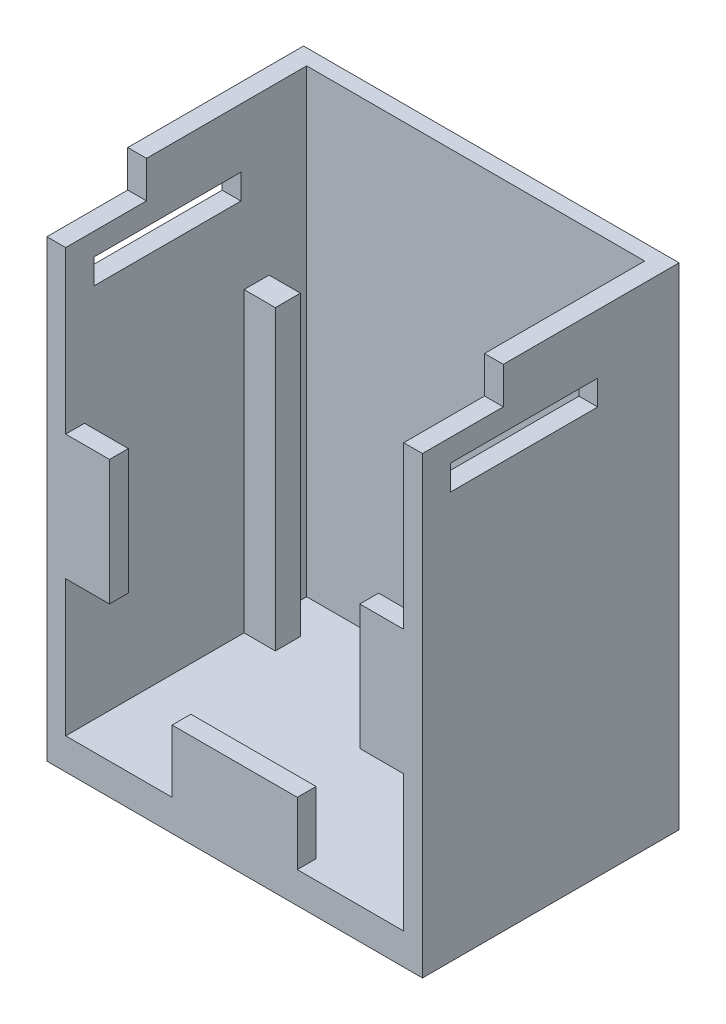
from build123d import *

# Parameters (mm, degrees)
INITIAL_BLOCK_DEPTH      = 19.05
INITIAL_BLOCK_DEPTH_BACK = 1.778
SKETCH1_W                = 30.48
SKETCH1_H                = 40.64
SKETCH2_W                = 27.432
SKETCH2_H                = 19.558
INITIAL_CUT_DEPTH        = 38.1
SKETCH20_W               = 5.08
SKETCH20_H               = 10.16
SKETCH20_W_2             = 10.16
SKETCH20_H_2             = 5.08
BOSS_EXTRUDE1_DEPTH      = 1.524
SKETCH21_W               = 2.032
SKETCH21_H               = 24.13
BOSS_EXTRUDE2_DEPTH      = 2.54
CUT_EXTRUDE6_REACH       = 46.012
SKETCH27_W               = 11.938
SKETCH27_H               = 2.032
SKETCH28_W               = 30.48
SKETCH28_H               = 1.778
CUT_EXTRUDE7_DEPTH       = 37.210815843
SKETCH29_W               = 30.48
SKETCH29_H               = 2
CUT_EXTRUDE8_DEPTH       = 5.81
BOSS_EXTRUDE3_DEPTH      = 0.99
SKETCH31_W               = 30.48
SKETCH31_H               = 2.99
CUT_EXTRUDE9_DEPTH       = 0.75


with BuildPart() as part:
    # Sketch1 → Initial Block (new, two sides: drawn at the far end of the back side and taken through both)
    with BuildSketch(Plane.XY.offset(-INITIAL_BLOCK_DEPTH_BACK)):
        with Locations((0, -5.08)):
            Rectangle(SKETCH1_W, SKETCH1_H)
    extrude(amount=INITIAL_BLOCK_DEPTH + INITIAL_BLOCK_DEPTH_BACK)

    # Sketch2 → Initial Cut (cut)
    with BuildSketch(Plane(origin=(0, 15.24, 0), x_dir=(1, 0, 0), z_dir=(0, 1, 0))):
        with Locations((0, -9.271)):
            Rectangle(SKETCH2_W, SKETCH2_H)
    extrude(amount=-INITIAL_CUT_DEPTH, mode=Mode.SUBTRACT)

    # Sketch20 → Boss-Extrude1 (add)
    with BuildSketch(Plane.XY.offset(19.05)):
        with Locations((-12.7, -6.731)):
            Rectangle(SKETCH20_W, SKETCH20_H)
        with Locations((12.7, -6.731)):
            Rectangle(SKETCH20_W, SKETCH20_H)
        with Locations((0, -20.32)):
            Rectangle(SKETCH20_W_2, SKETCH20_H_2)
    extrude(amount=-BOSS_EXTRUDE1_DEPTH)

    # Sketch21 → Boss-Extrude2 (add)
    with BuildSketch(Plane(origin=(-13.716, 0, 0), x_dir=(0, 0, -1), z_dir=(1, 0, 0))):
        with Locations((-3.556, -10.795)):
            Rectangle(SKETCH21_W, SKETCH21_H)
    boss_extrude2 = extrude(amount=BOSS_EXTRUDE2_DEPTH)

    # Mirror2: Boss-Extrude2 across plane
    add(boss_extrude2.mirror(Plane(origin=(0, 0, 0), x_dir=(0, 0, 1), z_dir=(1, 0, 0))))

    # Sketch27 → Cut-Extrude6 (cut, up to next)
    with BuildSketch(Plane(origin=(15.24, 0, 0), x_dir=(0, 0, -1), z_dir=(1, 0, 0)), mode=Mode.PRIVATE) as cut_extrude6_sk1:
        with Locations((-10.795, 8.636)):
            Rectangle(SKETCH27_W, SKETCH27_H)
    cut_extrude6_tool1 = extrude(cut_extrude6_sk1.sketch, amount=-CUT_EXTRUDE6_REACH, mode=Mode.PRIVATE) & part.part
    cut_extrude6 = cut_extrude6_tool1.solids().sort_by_distance((15.24, 8.636, 10.795))[0]
    add(cut_extrude6, mode=Mode.SUBTRACT)

    # Mirror6: Cut-Extrude6 across plane
    add(cut_extrude6.mirror(Plane(origin=(0, 0, 0), x_dir=(0, 0, 1), z_dir=(1, 0, 0))), mode=Mode.SUBTRACT)

    # Sketch28 → Cut-Extrude7 (cut, through all)
    with BuildSketch(Plane.XY.offset(19.05)):
        with Locations((0, 14.351)):
            Rectangle(SKETCH28_W, SKETCH28_H)
    extrude(amount=-CUT_EXTRUDE7_DEPTH, mode=Mode.SUBTRACT)

    # Sketch29 → Cut-Extrude8 (cut)
    with BuildSketch(Plane.XY.offset(19.05)):
        with Locations((0, 12.462)):
            Rectangle(SKETCH29_W, SKETCH29_H)
    extrude(amount=-CUT_EXTRUDE8_DEPTH, mode=Mode.SUBTRACT)

    # Sketch30 → Boss-Extrude3 (add)
    with BuildSketch(Plane(origin=(0, 13.462, 0), x_dir=(1, 0, 0), z_dir=(0, 1, 0))):
        Polygon((-15.24, -13.24), (-15.24, 1.778), (15.24, 1.778), (15.24, -13.24), (13.716, -13.24), (13.716, 0.508), (-13.716, 0.508), (-13.716, -13.24), align=None)
    extrude(amount=BOSS_EXTRUDE3_DEPTH)

    # Sketch31 → Cut-Extrude9 (cut)
    with BuildSketch(Plane.XY.offset(13.24)):
        with Locations((0, 12.957)):
            Rectangle(SKETCH31_W, SKETCH31_H)
    extrude(amount=-CUT_EXTRUDE9_DEPTH, mode=Mode.SUBTRACT)


solid = part.part
